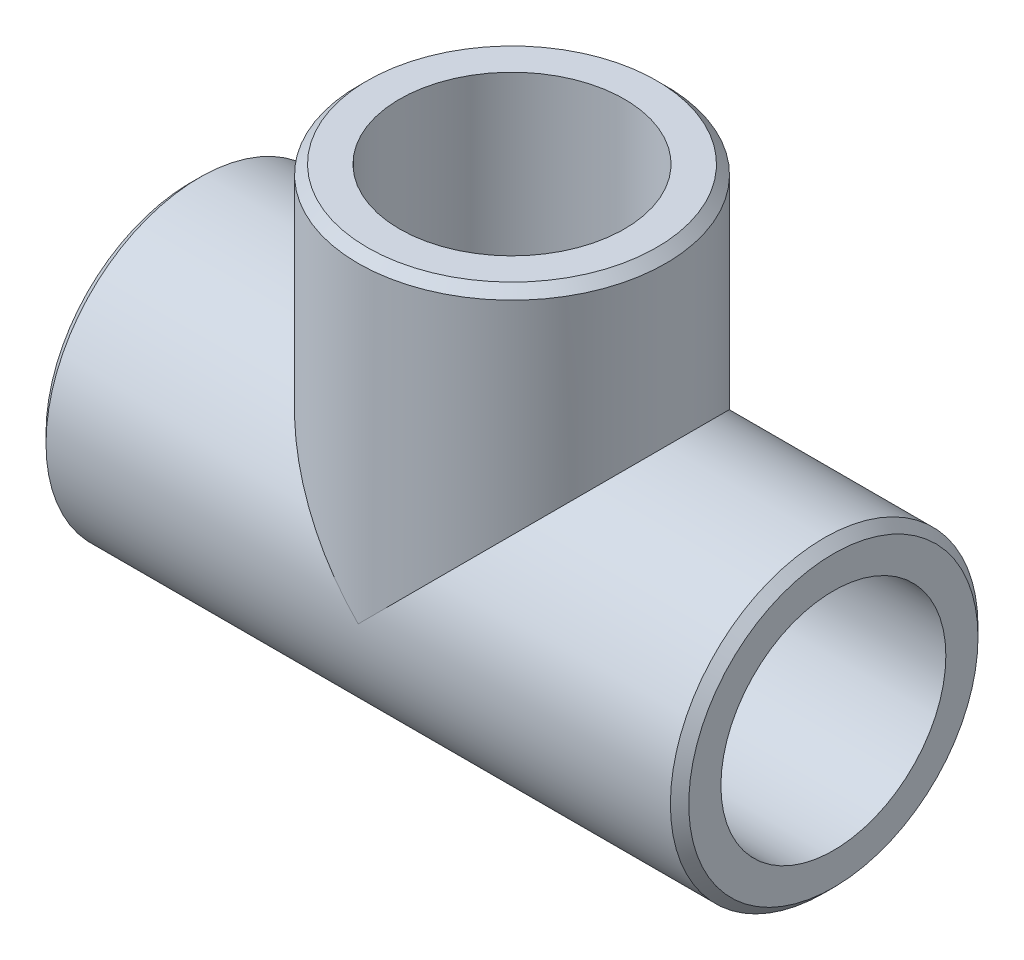
from build123d import *

# Parameters (mm, degrees)
RUNROUTE_R           = 16.75
RUNEXTRUDE_DEPTH     = 35
OUTLETROUTE_R        = 16.75
OUTLETEXTRUDE_DEPTH  = 35
TEESHELL_START       = -35
TEESHELL_OUTLINE_R   = 12.25
TEESHELL_DEPTH       = 70
TEESHELL_START_2     = -1e-07
TEESHELL_2_OUTLINE_R = 12.25
TEESHELL_2_DEPTH     = 35.0000001
TEECHAMFER_SIZE      = 1


with BuildPart() as part:
    # RunRoute → RunExtrude (new body)
    with BuildSketch(Plane(origin=(0, 0, 0), x_dir=(0, 0, -1), z_dir=(1, 0, 0))):
        Circle(RUNROUTE_R)
    runextrude = extrude(amount=RUNEXTRUDE_DEPTH)

    # RunExtrudeMirror: RunExtrude across plane
    add(runextrude.mirror(Plane(origin=(0, 0, 0), x_dir=(0, 0, 1), z_dir=(1, 0, 0))))

    # OutletRoute → OutletExtrude (add)
    with BuildSketch(Plane(origin=(0, 0, 0), x_dir=(1, 0, 0), z_dir=(0, 1, 0))):
        with Locations(Location((0, 0, 0), (0, 0, 270))):
            Circle(OUTLETROUTE_R)
    extrude(amount=OUTLETEXTRUDE_DEPTH)

    # TeeShell: read off the stored shape, not the designer's step
    # TeeShell outline → TeeShell (cut)
    with BuildSketch(Plane.YZ.offset(TEESHELL_START)):
        Circle(TEESHELL_OUTLINE_R)
    extrude(amount=TEESHELL_DEPTH, mode=Mode.SUBTRACT)

    # TeeShell 2 outline → TeeShell 2 (cut)
    with BuildSketch(Plane(origin=(0, 0, 0), x_dir=(1, 0, 0), z_dir=(0, 1, 0)).offset(TEESHELL_START_2)):
        Circle(TEESHELL_2_OUTLINE_R)
    extrude(amount=TEESHELL_2_DEPTH, mode=Mode.SUBTRACT)

    # TeeChamfer
    # the kernel refuses this chamfer: 1 mm, written as the material it takes off along each edge
    with BuildSketch(Plane(origin=(0, 35, 0), x_dir=(0, 0, 1), z_dir=(-1, 0, 0))) as teechamfer_piece_1:
        Polygon((16.75, -TEECHAMFER_SIZE), (16.75 - TEECHAMFER_SIZE, 0), (16.75, 0), align=None)
    revolve(axis=Axis((0, 35, 0), (0, 1, 0)), mode=Mode.SUBTRACT)
    with BuildSketch(Plane(origin=(35, 0, 0), x_dir=(0, 0, -1), z_dir=(0, -1, 0))) as teechamfer_piece_2:
        Polygon((16.75, -TEECHAMFER_SIZE), (16.75 - TEECHAMFER_SIZE, 0), (16.75, 0), align=None)
    revolve(axis=Axis((35, 0, 0), (1, 0, 0)), mode=Mode.SUBTRACT)
    with BuildSketch(Plane(origin=(-35, 0, 0), x_dir=(0, 0, -1), z_dir=(0, -1, 0))) as teechamfer_piece_3:
        Polygon((16.75, TEECHAMFER_SIZE), (16.75 - TEECHAMFER_SIZE, 0), (16.75, 0), align=None)
    revolve(axis=Axis((-35, 0, 0), (1, 0, 0)), mode=Mode.SUBTRACT)


solid = part.part
